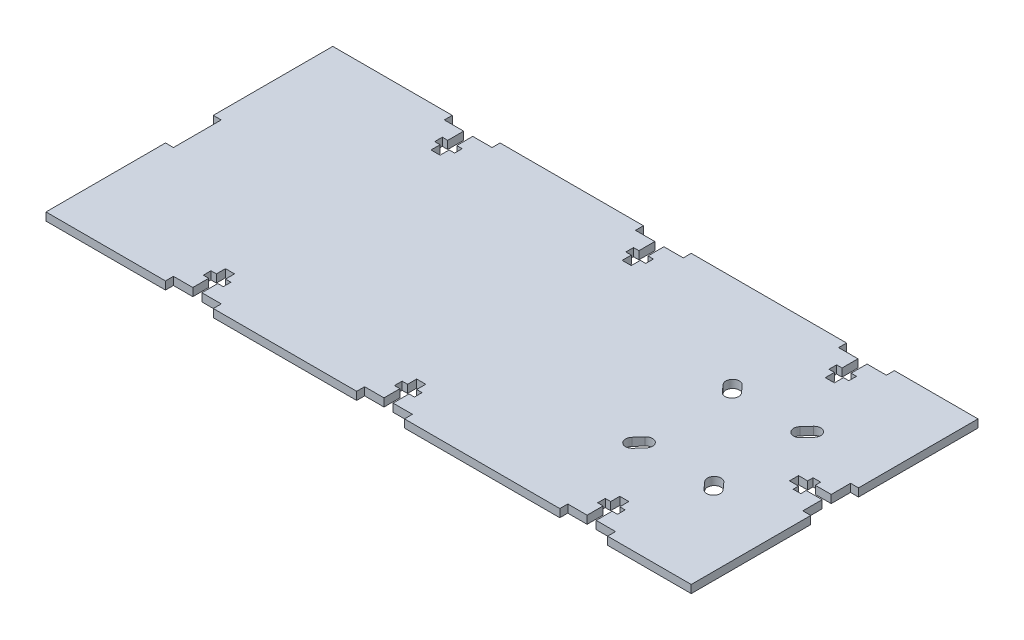
from build123d import *

# Parameters (mm, degrees)
BOSS_EXTRUDE1_DEPTH = 2.54
CUT_EXTRUDE1_REACH  = 114.601


with BuildPart() as part:
    # Sketch2 → Boss-Extrude1 (new body)
    with BuildSketch(Plane(origin=(0, 0, 0), x_dir=(1, 0, 0), z_dir=(0, 1, 0))):
        Polygon((-102.87, -45.72), (-64.77, -45.72), (-64.77, -43.18), (-58.5978, -43.18), (-58.5978, -38.1), (-60.325, -38.1), (-60.325, -35.66795), (-58.5978, -35.66795), (-58.5978, -32.766), (-55.7022, -32.766), (-55.7022, -35.66795), (-53.975, -35.66795), (-53.975, -38.1), (-55.7022, -38.1), (-55.7022, -43.18), (-49.53, -43.18), (-49.53, -45.72), (-3.81, -45.72), (-3.81, -43.18), (2.3622, -43.18), (2.3622, -38.1), (0.635, -38.1), (0.635, -35.66795), (2.3622, -35.66795), (2.3622, -32.766), (5.2578, -32.766), (5.2578, -35.66795), (6.985, -35.66795), (6.985, -38.1), (5.2578, -38.1), (5.2578, -43.18), (11.43, -43.18), (11.43, -45.72), (60.96, -45.72), (60.96, -43.18), (67.1322, -43.18), (67.1322, -38.1), (65.405, -38.1), (65.405, -35.66795), (67.1322, -35.66795), (67.1322, -32.766), (70.0278, -32.766), (70.0278, -35.66795), (71.755, -35.66795), (71.755, -38.1), (70.0278, -38.1), (70.0278, -43.18), (76.2, -43.18), (76.2, -45.72), (102.87, -45.72), (102.87, -7.62), (100.33, -7.62), (100.33, -1.4478), (95.25, -1.4478), (95.25, -3.175), (92.81795, -3.175), (92.81795, -1.4478), (89.916, -1.4478), (89.916, 1.4478), (92.81795, 1.4478), (92.81795, 3.175), (95.25, 3.175), (95.25, 1.4478), (100.33, 1.4478), (100.33, 7.62), (102.87, 7.62), (102.87, 45.72), (76.2, 45.72), (76.2, 43.18), (70.0278, 43.18), (70.0278, 38.1), (71.755, 38.1), (71.755, 35.66795), (70.0278, 35.66795), (70.0278, 32.766), (67.1322, 32.766), (67.1322, 35.66795), (65.405, 35.66795), (65.405, 38.1), (67.1322, 38.1), (67.1322, 43.18), (60.96, 43.18), (60.96, 45.72), (11.43, 45.72), (11.43, 43.18), (5.2578, 43.18), (5.2578, 38.1), (6.985, 38.1), (6.985, 35.66795), (5.2578, 35.66795), (5.2578, 32.766), (2.3622, 32.766), (2.3622, 35.66795), (0.635, 35.66795), (0.635, 38.1), (2.3622, 38.1), (2.3622, 43.18), (-3.81, 43.18), (-3.81, 45.72), (-49.53, 45.72), (-49.53, 43.18), (-55.7022, 43.18), (-55.7022, 38.1), (-53.975, 38.1), (-53.975, 35.66795), (-55.7022, 35.66795), (-55.7022, 32.766), (-58.5978, 32.766), (-58.5978, 35.66795), (-60.325, 35.66795), (-60.325, 38.1), (-58.5978, 38.1), (-58.5978, 43.18), (-64.77, 43.18), (-64.77, 45.72), (-102.87, 45.72), (-102.87, 7.62), (-100.33, 7.62), (-100.33, -7.62), (-102.87, -7.62), align=None)
    extrude(amount=-BOSS_EXTRUDE1_DEPTH)

    # Sketch3 → Cut-Extrude1 (cut, up to next)
    with BuildSketch(Plane(origin=(0, 0, 0), x_dir=(1, 0, 0), z_dir=(0, 1, 0)), mode=Mode.PRIVATE) as cut_extrude1_sk1:
        with BuildLine():
            Line((81.873223588, 14.562666667), (79.841223588, 12.290821602))
            ThreePointArc((79.841223588, 12.290821602), (76.792666667, 12.120931347), (76.622776412, 15.169488268))
            Line((76.622776412, 15.169488268), (78.654776412, 17.441333333))
            ThreePointArc((78.654776412, 17.441333333), (81.703333333, 17.611223588), (81.873223588, 14.562666667))
        make_face()
    cut_extrude1_tool1 = extrude(cut_extrude1_sk1.sketch, amount=-CUT_EXTRUDE1_REACH, mode=Mode.PRIVATE) & part.part
    # Sketch3 → Cut-Extrude1 (cut, up to next)
    with BuildSketch(Plane(origin=(0, 0, 0), x_dir=(1, 0, 0), z_dir=(0, 1, 0)), mode=Mode.PRIVATE) as cut_extrude1_sk2:
        with BuildLine():
            Line((52.746776412, 14.562666667), (54.778776412, 12.290821602))
            ThreePointArc((54.778776412, 12.290821602), (57.827333333, 12.120931347), (57.997223588, 15.169488268))
            Line((57.997223588, 15.169488268), (55.965223588, 17.441333333))
            ThreePointArc((55.965223588, 17.441333333), (52.916666667, 17.611223588), (52.746776412, 14.562666667))
        make_face()
    cut_extrude1_tool2 = extrude(cut_extrude1_sk2.sketch, amount=-CUT_EXTRUDE1_REACH, mode=Mode.PRIVATE) & part.part
    # Sketch3 → Cut-Extrude1 (cut, up to next)
    with BuildSketch(Plane(origin=(0, 0, 0), x_dir=(1, 0, 0), z_dir=(0, 1, 0)), mode=Mode.PRIVATE) as cut_extrude1_sk3:
        with BuildLine():
            Line((81.873223588, -14.562666667), (79.841223588, -12.290821602))
            ThreePointArc((79.841223588, -12.290821602), (76.792666667, -12.120931347), (76.622776412, -15.169488268))
            Line((76.622776412, -15.169488268), (78.654776412, -17.441333333))
            ThreePointArc((78.654776412, -17.441333333), (81.703333333, -17.611223588), (81.873223588, -14.562666667))
        make_face()
    cut_extrude1_tool3 = extrude(cut_extrude1_sk3.sketch, amount=-CUT_EXTRUDE1_REACH, mode=Mode.PRIVATE) & part.part
    # Sketch3 → Cut-Extrude1 (cut, up to next)
    with BuildSketch(Plane(origin=(0, 0, 0), x_dir=(1, 0, 0), z_dir=(0, 1, 0)), mode=Mode.PRIVATE) as cut_extrude1_sk4:
        with BuildLine():
            Line((52.746776412, -14.562666667), (54.778776412, -12.290821602))
            ThreePointArc((54.778776412, -12.290821602), (57.827333333, -12.120931347), (57.997223588, -15.169488268))
            Line((57.997223588, -15.169488268), (55.965223588, -17.441333333))
            ThreePointArc((55.965223588, -17.441333333), (52.916666667, -17.611223588), (52.746776412, -14.562666667))
        make_face()
    cut_extrude1_tool4 = extrude(cut_extrude1_sk4.sketch, amount=-CUT_EXTRUDE1_REACH, mode=Mode.PRIVATE) & part.part
    add(cut_extrude1_tool1.solids().sort_by_distance((79.248, 0, -14.866077))[0], mode=Mode.SUBTRACT)
    add(cut_extrude1_tool2.solids().sort_by_distance((55.372, 0, -14.866077))[0], mode=Mode.SUBTRACT)
    add(cut_extrude1_tool3.solids().sort_by_distance((79.248, 0, 14.866077))[0], mode=Mode.SUBTRACT)
    add(cut_extrude1_tool4.solids().sort_by_distance((55.372, 0, 14.866077))[0], mode=Mode.SUBTRACT)


solid = part.part
